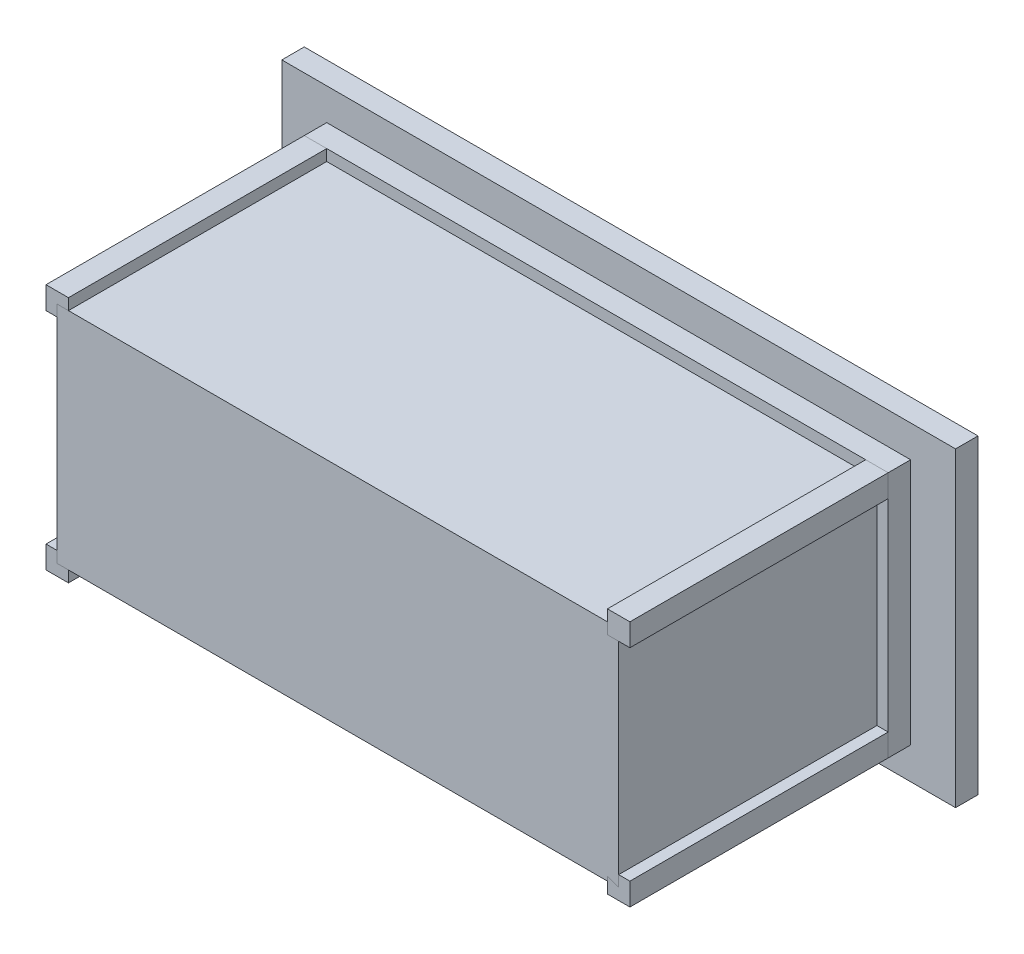
from build123d import *

# Parameters (mm, degrees)
SKETCH2_W                               = 500
SKETCH2_H                               = 240
BOSS_EXTRUDE1_DEPTH                     = 200
SQUARE_RODS_START                       = -10
SQUARE_RODS_SQUARE_BAR_20_2_OUTLINE_W   = 20
SQUARE_RODS_SQUARE_BAR_20_2_OUTLINE_H   = 230
SQUARE_RODS_SQUARE_BAR_20_2_DEPTH       = 20
SQUARE_RODS_START_2                     = -130
SQUARE_RODS_SQUARE_BAR_20_2_2_DEPTH     = 20
SQUARE_RODS_SQUARE_BAR_20_2_3_DEPTH     = 20
SQUARE_RODS_SQUARE_BAR_20_2_4_OUTLINE_W = 20
SQUARE_RODS_SQUARE_BAR_20_2_4_OUTLINE_H = 230
SQUARE_RODS_SQUARE_BAR_20_2_4_DEPTH     = 20
SQUARE_RODS_SQUARE_BAR_20_2_5_DEPTH     = 20
SQUARE_RODS_START_3                     = 190
SQUARE_RODS_SQUARE_BAR_20_2_6_OUTLINE_W = 20
SQUARE_RODS_SQUARE_BAR_20_2_6_OUTLINE_H = 230
SQUARE_RODS_SQUARE_BAR_20_2_6_DEPTH     = 20
SQUARE_RODS_SQUARE_BAR_20_2_7_DEPTH     = 20
SQUARE_RODS_SQUARE_BAR_20_2_8_OUTLINE_W = 20
SQUARE_RODS_SQUARE_BAR_20_2_8_OUTLINE_H = 230
SQUARE_RODS_SQUARE_BAR_20_2_8_DEPTH     = 20
SKETCH8_W                               = 600
SKETCH8_H                               = 276.75915278
BOSS_EXTRUDE2_DEPTH                     = 20
CUT_EXTRUDE4_DEPTH                      = 458.520297298
CUT_EXTRUDE4_DEPTH_BACK                 = 0.01
SKETCH9_R                               = 5


# Read off the part's stored shape, not the designer's step: Square-rods SQUARE BAR 20(2)
with BuildPart() as part:
    # Sketch2 → Boss-Extrude1 (new body)
    with BuildSketch(Plane(origin=(0, 0, 0), x_dir=(1, 0, 0), z_dir=(0, 1, 0))):
        Rectangle(SKETCH2_W, SKETCH2_H)
    extrude(amount=BOSS_EXTRUDE1_DEPTH)


with BuildPart() as body_2:
    # Square-rods SQUARE BAR 20(2) outline → Square-rods SQUARE BAR 20(2) (new body)
    with BuildSketch(Plane(origin=(0, 0, 0), x_dir=(1, 0, 0), z_dir=(0, 1, 0)).offset(SQUARE_RODS_START)):
        with Locations((-250, -5)):
            Rectangle(SQUARE_RODS_SQUARE_BAR_20_2_OUTLINE_W, SQUARE_RODS_SQUARE_BAR_20_2_OUTLINE_H)
    extrude(amount=SQUARE_RODS_SQUARE_BAR_20_2_DEPTH)


with BuildPart() as body_3:
    # Square-rods SQUARE BAR 20_2 2 outline → Square-rods SQUARE BAR 20_2 2 (new body)
    with BuildSketch(Plane.XY.offset(SQUARE_RODS_START_2)):
        Polygon((-260, -10), (260, -10), (240, 10), (-240, 10), align=None)
    extrude(amount=SQUARE_RODS_SQUARE_BAR_20_2_2_DEPTH)


with BuildPart() as body_4:
    # Square-rods SQUARE BAR 20_2 3 outline → Square-rods SQUARE BAR 20_2 3 (new body)
    with BuildSketch(Plane.XY.offset(SQUARE_RODS_START_2)):
        Polygon((-260, 210), (-260, -10), (-240, 10), (-240, 190), align=None)
    extrude(amount=SQUARE_RODS_SQUARE_BAR_20_2_3_DEPTH)


with BuildPart() as body_5:
    # Square-rods SQUARE BAR 20_2 4 outline → Square-rods SQUARE BAR 20_2 4 (new body)
    with BuildSketch(Plane(origin=(0, 0, 0), x_dir=(1, 0, 0), z_dir=(0, 1, 0)).offset(SQUARE_RODS_START)):
        with Locations((250, -5)):
            Rectangle(SQUARE_RODS_SQUARE_BAR_20_2_4_OUTLINE_W, SQUARE_RODS_SQUARE_BAR_20_2_4_OUTLINE_H)
    extrude(amount=SQUARE_RODS_SQUARE_BAR_20_2_4_DEPTH)


with BuildPart() as body_6:
    # Square-rods SQUARE BAR 20_2 5 outline → Square-rods SQUARE BAR 20_2 5 (new body)
    with BuildSketch(Plane.XY.offset(SQUARE_RODS_START_2)):
        Polygon((260, -10), (260, 210), (240, 190), (240, 10), align=None)
    extrude(amount=SQUARE_RODS_SQUARE_BAR_20_2_5_DEPTH)


with BuildPart() as body_7:
    # Square-rods SQUARE BAR 20_2 6 outline → Square-rods SQUARE BAR 20_2 6 (new body)
    with BuildSketch(Plane(origin=(0, 0, 0), x_dir=(1, 0, 0), z_dir=(0, 1, 0)).offset(SQUARE_RODS_START_3)):
        with Locations((250, -5)):
            Rectangle(SQUARE_RODS_SQUARE_BAR_20_2_6_OUTLINE_W, SQUARE_RODS_SQUARE_BAR_20_2_6_OUTLINE_H)
    extrude(amount=SQUARE_RODS_SQUARE_BAR_20_2_6_DEPTH)


with BuildPart() as body_8:
    # Square-rods SQUARE BAR 20_2 7 outline → Square-rods SQUARE BAR 20_2 7 (new body)
    with BuildSketch(Plane.XY.offset(SQUARE_RODS_START_2)):
        Polygon((260, 210), (-260, 210), (-240, 190), (240, 190), align=None)
    extrude(amount=SQUARE_RODS_SQUARE_BAR_20_2_7_DEPTH)


with BuildPart() as body_9:
    # Square-rods SQUARE BAR 20_2 8 outline → Square-rods SQUARE BAR 20_2 8 (new body)
    with BuildSketch(Plane(origin=(0, 0, 0), x_dir=(1, 0, 0), z_dir=(0, 1, 0)).offset(SQUARE_RODS_START_3)):
        with Locations((-250, -5)):
            Rectangle(SQUARE_RODS_SQUARE_BAR_20_2_8_OUTLINE_W, SQUARE_RODS_SQUARE_BAR_20_2_8_OUTLINE_H)
    extrude(amount=SQUARE_RODS_SQUARE_BAR_20_2_8_DEPTH)


with BuildPart() as body_10:
    # Sketch8 → Boss-Extrude2 (new body)
    with BuildSketch(Plane(origin=(0, 0, -130), x_dir=(-1, 0, 0), z_dir=(0, 0, -1))):
        with Locations((0, 100)):
            Rectangle(SKETCH8_W, SKETCH8_H)
    extrude(amount=BOSS_EXTRUDE2_DEPTH)


with BuildPart() as cut_extrude4_tool:
    # Sketch9 → Cut-Extrude4 (new, two sides: drawn at the far end of the back side and taken through both)
    with BuildSketch(Plane(origin=(0, 0, -130), x_dir=(-1, 0, 0), z_dir=(0, 0, -1)).offset(-CUT_EXTRUDE4_DEPTH_BACK)):
        with Locations(Location((-250, 200, 0), (0, 0, 180))):
            Circle(SKETCH9_R)
        with Locations(Location((250, 200, 0), (0, 0, 180))):
            Circle(SKETCH9_R)
        with Locations(Location((250, 0, 0), (0, 0, 180))):
            Circle(SKETCH9_R)
        with Locations(Location((-250, 0, 0), (0, 0, 180))):
            Circle(SKETCH9_R)
    extrude(amount=CUT_EXTRUDE4_DEPTH + CUT_EXTRUDE4_DEPTH_BACK)


with BuildPart() as body_3_1:
    add(body_3.part)

    # Cut-Extrude4: cut by cut_extrude4_tool
    add(cut_extrude4_tool.part, mode=Mode.SUBTRACT)


with BuildPart() as body_4_1:
    add(body_4.part)

    # Cut-Extrude4: cut by cut_extrude4_tool
    add(cut_extrude4_tool.part, mode=Mode.SUBTRACT)


with BuildPart() as body_6_1:
    add(body_6.part)

    # Cut-Extrude4: cut by cut_extrude4_tool
    add(cut_extrude4_tool.part, mode=Mode.SUBTRACT)


with BuildPart() as body_8_1:
    add(body_8.part)

    # Cut-Extrude4: cut by cut_extrude4_tool
    add(cut_extrude4_tool.part, mode=Mode.SUBTRACT)


with BuildPart() as body_10_1:
    add(body_10.part)

    # Cut-Extrude4: cut by cut_extrude4_tool
    add(cut_extrude4_tool.part, mode=Mode.SUBTRACT)


solid = Compound([part.part, body_2.part, body_5.part, body_7.part, body_9.part, body_3_1.part, body_4_1.part, body_6_1.part, body_8_1.part, body_10_1.part])
